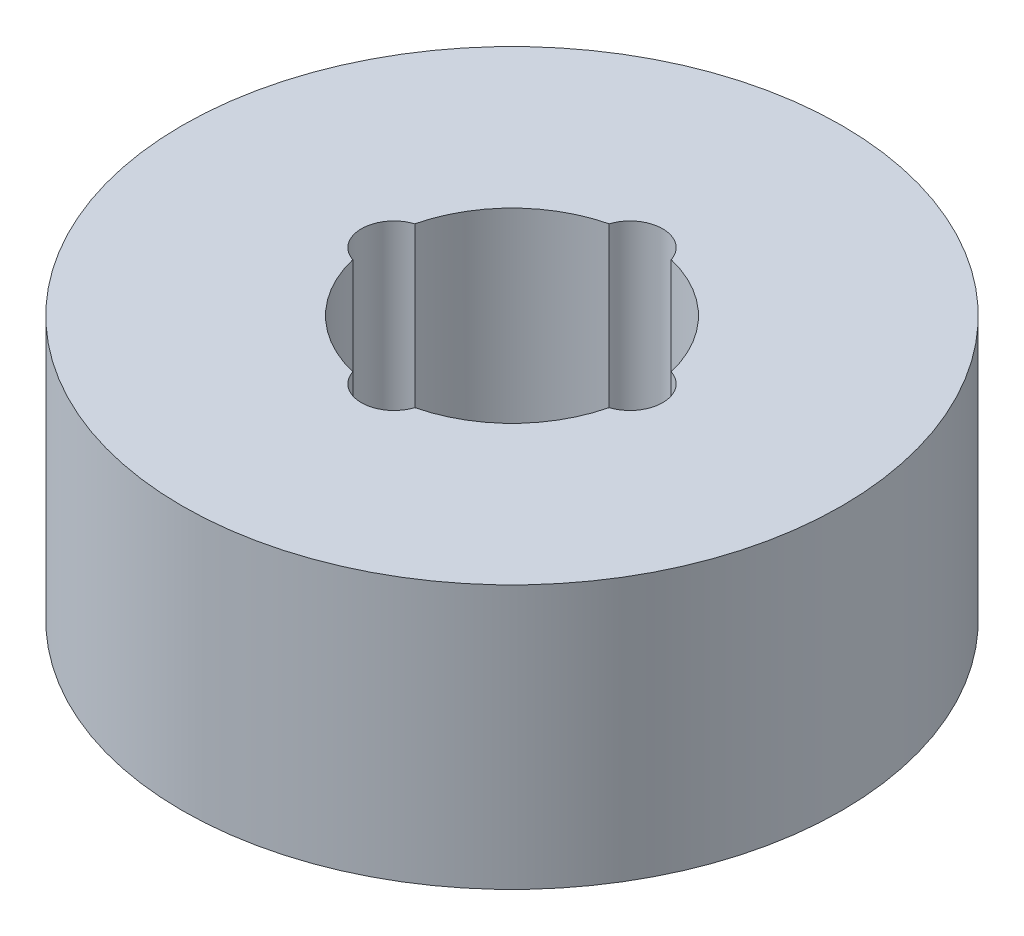
from build123d import *

# Parameters (mm, degrees)
SKETCH1_R           = 25
BOSS_EXTRUDE1_DEPTH = 20
SKETCH2_R           = 10
CUT_EXTRUDE1_DEPTH  = 41.620192023
SKETCH3_R           = 2.477919301
CUT_EXTRUDE2_DEPTH  = 18.02771459
CIRPATTERN1_COUNT   = 4


with BuildPart() as part:
    # Sketch1 → Boss-Extrude1 (new body)
    with BuildSketch(Plane(origin=(0, 0, 0), x_dir=(1, 0, 0), z_dir=(0, 1, 0))):
        Circle(SKETCH1_R)
    extrude(amount=BOSS_EXTRUDE1_DEPTH)

    # Sketch2 → Cut-Extrude1 (cut, through all)
    with BuildSketch(Plane(origin=(0, 0, 0), x_dir=(1, 0, 0), z_dir=(0, 1, 0))):
        Circle(SKETCH2_R)
    extrude(amount=CUT_EXTRUDE1_DEPTH, mode=Mode.SUBTRACT)

    # Sketch3 → Cut-Extrude2 (cut)
    with BuildSketch(Plane(origin=(0, 20, 0), x_dir=(1, 0, 0), z_dir=(0, 1, 0))):
        with Locations((-8.945303636, 0)):
            Circle(SKETCH3_R)
    cut_extrude2 = extrude(amount=-CUT_EXTRUDE2_DEPTH, mode=Mode.SUBTRACT)

    # CirPattern1: Cut-Extrude2 ×4 about axis
    cirpattern1_axis = Axis((0, 0, 0), (0, 1, 0))
    for i in range(1, CIRPATTERN1_COUNT):
        add(cut_extrude2.rotate(cirpattern1_axis, i * 360 / CIRPATTERN1_COUNT), mode=Mode.SUBTRACT)


solid = part.part
